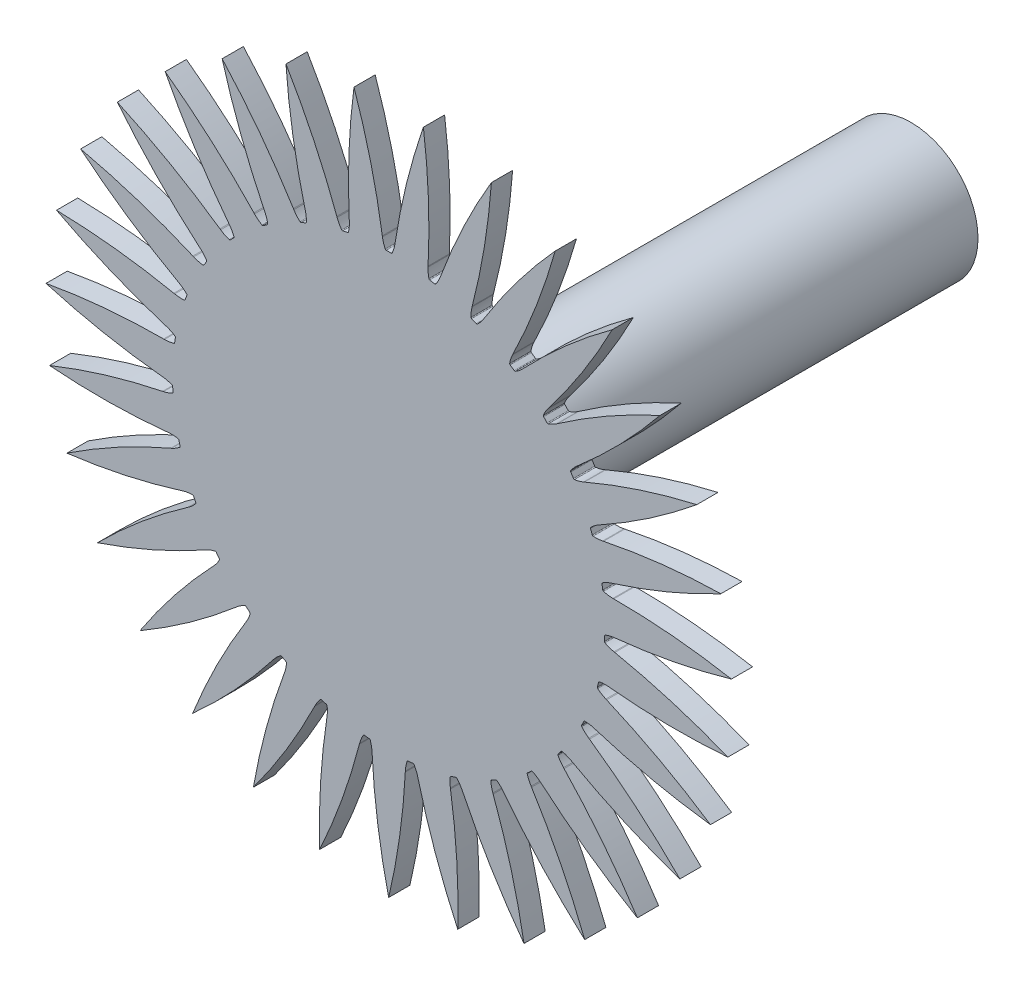
from build123d import *

# Parameters (mm, degrees)
SKETCH1_R                = 500
EXTRUDE1_DEPTH           = 12.7
CUT_EXTRUDE1_DEPTH       = 708.220821243
FILLET1_R                = 0.635
CIRPATTERN1_COUNT        = 31
FILLET1_OF_CIRPATTERN1_R = 0.635
SKETCH3_R                = 40
EXTRUDE2_DEPTH           = 300


with BuildPart() as part:
    # Sketch1 → Extrude1 (new body)
    with BuildSketch(Plane.XY):
        Circle(SKETCH1_R)
    extrude(amount=EXTRUDE1_DEPTH)

    # Sketch2 → Cut-Extrude1 (cut, symmetric)
    with BuildSketch(Plane.XY.offset(12.7)):
        with BuildLine():
            Line((-2460.940364062, 1353.146977655), (-241.231460808, 437.958196997))
            ThreePointArc((-241.231460808, 437.958196997), (-82.810970136, 318.022108626), (-3.81, 135.702159428))
            Line((-3.81, 135.702159428), (-3.732214889, 135.194159428))
            ThreePointArc((-3.732214889, 135.194159428), (-3.039845854, 132.203962215), (-1.905, 129.352159428))
            ThreePointArc((-1.905, 129.352159428), (0, 129.366186361), (1.905, 129.352159428))
            ThreePointArc((1.905, 129.352159428), (3.039845854, 132.203962215), (3.732214889, 135.194159428))
            Line((3.732214889, 135.194159428), (3.81, 135.702159428))
            ThreePointArc((3.81, 135.702159428), (82.810970136, 318.022108626), (241.231460808, 437.958196997))
            Line((241.231460808, 437.958196997), (2460.940364062, 1353.146977655))
            Line((2460.940364062, 1353.146977655), (2460.940364062, 6155.095798468))
            Line((2460.940364062, 6155.095798468), (-2460.940364062, 6155.095798468))
            Line((-2460.940364062, 6155.095798468), (-2460.940364062, 1353.146977655))
        make_face()
    cut_extrude1 = extrude(amount=CUT_EXTRUDE1_DEPTH, both=True, mode=Mode.SUBTRACT)

    # Fillet1
    fillet1_edges = [part.edges().sort_by_distance(p)[0] for p in [
        (1.905, 129.352159428, 6.35),
        (-1.905, 129.352159428, 6.35),
    ]]
    fillet(fillet1_edges, radius=FILLET1_R)

    # CirPattern1: Cut-Extrude1 ×31 about axis
    cirpattern1_axis = Axis((0, 0, 12.7), (0, 0, -1))
    for i in range(1, CIRPATTERN1_COUNT):
        add(cut_extrude1.rotate(cirpattern1_axis, i * 360 / CIRPATTERN1_COUNT), mode=Mode.SUBTRACT)

    # Fillet1 of CirPattern1
    fillet1_of_cirpattern1_edges = [part.edges().sort_by_distance(p)[0] for p in [
        (27.904402801, 126.320839444, 6.35),
        (24.172393725, 127.087786806, 6.35),
        (52.761396073, 118.117929452, 6.35),
        (49.260166811, 119.62042526, 6.35),
        (75.45833159, 105.07925755, 6.35),
        (72.331222879, 107.255789449, 6.35),
        (95.065994147, 87.738628497, 6.35),
        (92.441030185, 90.500089016, 6.35),
        (110.781643733, 66.805969685, 6.35),
        (108.766290853, 70.039304306, 6.35),
        (121.961879808, 43.138266624, 6.35),
        (120.638646795, 46.711102248, 6.35),
        (128.148982194, 17.70447786, 6.35),
        (127.572042362, 21.470542175, 6.35),
        (129.089650192, -8.454134309, 6.35),
        (129.282623525, -4.649024416, 6.35),
        (124.745372744, -34.266633225, 6.35),
        (125.700358892, -30.578259402, 6.35),
        (115.294005079, -58.676252151, 6.35),
        (116.971906796, -55.255616855, 6.35),
        (101.122487299, -80.68365842, 6.35),
        (103.454611093, -77.670802862, 6.35),
        (82.811003008, -99.387866233, 6.35),
        (85.701871456, -96.906137074, 6.35),
        (61.109226524, -114.023123125, 6.35),
        (64.440487132, -112.174122648, 6.35),
        (36.905631126, -123.990259959, 6.35),
        (40.540901693, -122.849686461, 6.35),
        (11.191114854, -128.881220983, 6.35),
        (14.981566976, -128.495769676, 6.35),
        (-14.981566976, -128.495769676, 6.35),
        (-11.191114854, -128.881220983, 6.35),
        (-40.540901693, -122.849686461, 6.35),
        (-36.905631126, -123.990259959, 6.35),
        (-64.440487132, -112.174122648, 6.35),
        (-61.109226524, -114.023123125, 6.35),
        (-85.701871456, -96.906137074, 6.35),
        (-82.811003008, -99.387866233, 6.35),
        (-103.454611093, -77.670802862, 6.35),
        (-101.122487299, -80.68365842, 6.35),
        (-116.971906796, -55.255616855, 6.35),
        (-115.294005079, -58.676252151, 6.35),
        (-125.700358892, -30.578259402, 6.35),
        (-124.745372744, -34.266633225, 6.35),
        (-129.282623525, -4.649024416, 6.35),
        (-129.089650192, -8.454134309, 6.35),
        (-127.572042362, 21.470542175, 6.35),
        (-128.148982194, 17.70447786, 6.35),
        (-120.638646795, 46.711102248, 6.35),
        (-121.961879808, 43.138266624, 6.35),
        (-108.766290853, 70.039304306, 6.35),
        (-110.781643733, 66.805969685, 6.35),
        (-92.441030185, 90.500089016, 6.35),
        (-95.065994147, 87.738628497, 6.35),
        (-72.331222879, 107.255789449, 6.35),
        (-75.45833159, 105.07925755, 6.35),
        (-49.260166811, 119.62042526, 6.35),
        (-52.761396073, 118.117929452, 6.35),
        (-24.172393725, 127.087786806, 6.35),
        (-27.904402801, 126.320839444, 6.35),
    ]]
    fillet(fillet1_of_cirpattern1_edges, radius=FILLET1_OF_CIRPATTERN1_R)

    # Sketch3 → Extrude2 (add)
    with BuildSketch(Plane(origin=(0, 0, 0), x_dir=(-1, 0, 0), z_dir=(0, 0, -1))):
        Circle(SKETCH3_R)
    extrude(amount=EXTRUDE2_DEPTH)


solid = part.part
